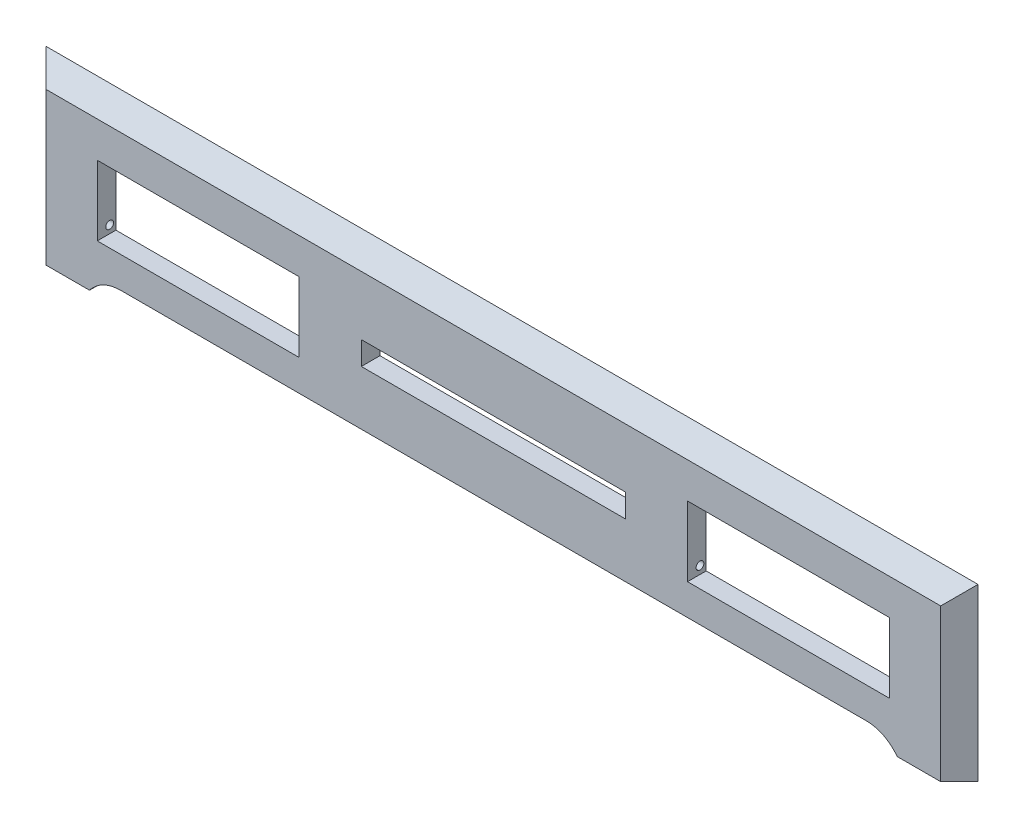
from build123d import *

# Parameters (mm, degrees)
BOSS_EXTRUDE1_DEPTH = 12
SKETCH2_W           = 130
SKETCH2_H           = 45
SKETCH2_W_2         = 170
SKETCH2_H_2         = 15
CUT_EXTRUDE1_DEPTH  = 609.394608786
CHAMFER1_SIZE       = 12
CUT_EXTRUDE2_START  = -10
SKETCH3_R           = 2.5
CUT_EXTRUDE2_DEPTH  = 150
CUT_EXTRUDE3_START  = 370
SKETCH3_2_R         = 2.5
CUT_EXTRUDE3_DEPTH  = 150


with BuildPart() as part:
    # Sketch1 → Boss-Extrude1 (new body)
    with BuildSketch(Plane.XY):
        with BuildLine():
            Line((0, 0), (0, -10))
            Line((0, -10), (40, -10))
            ThreePointArc((40, -10), (48.819660113, -2.639320225), (60, 0))
            Line((60, 0), (540, 0))
            ThreePointArc((540, 0), (551.180339887, -2.639320225), (560, -10))
            Line((560, -10), (600, -10))
            Line((600, -10), (600, 0))
            Line((600, 0), (600, 100))
            Line((600, 100), (0, 100))
            Line((0, 100), (0, 0))
        make_face()
    extrude(amount=BOSS_EXTRUDE1_DEPTH)

    # Sketch2 → Cut-Extrude1 (cut, through all)
    with BuildSketch(Plane.XY.offset(12)):
        with Locations((110, 42.5)):
            Rectangle(SKETCH2_W, SKETCH2_H)
        with Locations((300, 42.5)):
            Rectangle(SKETCH2_W_2, SKETCH2_H_2)
        with Locations((490, 42.5)):
            Rectangle(SKETCH2_W, SKETCH2_H)
    extrude(amount=-CUT_EXTRUDE1_DEPTH, mode=Mode.SUBTRACT)

    # Chamfer1
    chamfer1_edges = [part.edges().sort_by_distance(p)[0] for p in [
        (600, 45, 12),
        (300, 100, 12),
        (0, 45, 12),
    ]]
    chamfer(chamfer1_edges, length=CHAMFER1_SIZE - 0.0001)  # a hair under: the kernel refuses the full size

    # Sketch3 → Cut-Extrude2 (cut)
    with BuildSketch(Plane(origin=(45, 0, 0), x_dir=(0, 0, -1), z_dir=(1, 0, 0)).offset(CUT_EXTRUDE2_START)):
        with Locations((-4, 25)):
            Circle(SKETCH3_R)
    extrude(amount=CUT_EXTRUDE2_DEPTH, mode=Mode.SUBTRACT)

    # Sketch3<2> → Cut-Extrude3 (cut)
    with BuildSketch(Plane(origin=(45, 0, 0), x_dir=(0, 0, -1), z_dir=(1, 0, 0)).offset(CUT_EXTRUDE3_START)):
        with Locations((-4, 25)):
            Circle(SKETCH3_2_R)
    extrude(amount=CUT_EXTRUDE3_DEPTH, mode=Mode.SUBTRACT)


solid = part.part
